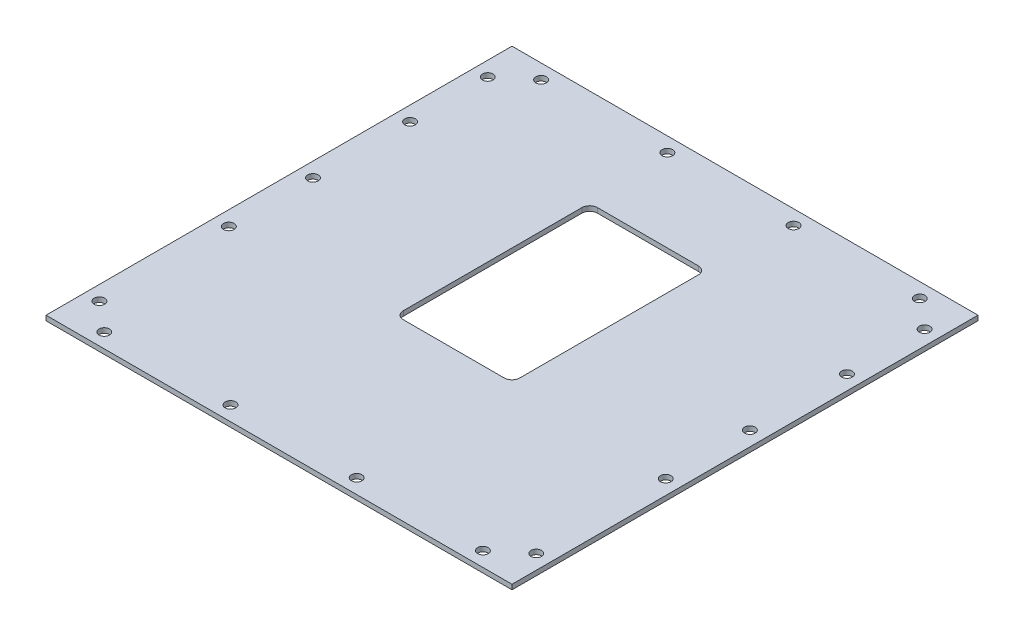
from build123d import *

# Parameters (mm, degrees)
SKETCH2_W                 = 152.4
SKETCH2_H                 = 152.4
BOSS_EXTRUDE1_DEPTH       = 1.5875
F_5_CLEARANCE_HOLE2_D     = 3.4544
F_5_CLEARANCE_HOLE3_D     = 3.4544
LPATTERN1_COUNT           = 4
LPATTERN1_PITCH           = 42.333333333
LPATTERN2_COUNT           = 4
LPATTERN2_PITCH           = 41.275
F_5_CLEARANCE_HOLE4_D     = 3.4544
F_5_CLEARANCE_HOLE4_DEPTH = 12.7
F_5_CLEARANCE_HOLE4_TIP   = 1.037806461
SKETCH12_W                = 38.1
SKETCH12_H                = 63.5
CUT_EXTRUDE1_DEPTH        = 2.54
FILLET2_R                 = 2.54


with BuildPart() as part:
    # Sketch2 → Boss-Extrude1 (new body)
    with BuildSketch(Plane(origin=(0, 0, 0), x_dir=(1, 0, 0), z_dir=(0, 1, 0))):
        with Locations((76.2, 76.2)):
            Rectangle(SKETCH2_W, SKETCH2_H)
    extrude(amount=BOSS_EXTRUDE1_DEPTH)

    # #5 Clearance Hole2 (through all)
    with Locations(Plane(origin=(0, 1.5875, 0), x_dir=(1, 0, 0), z_dir=(0, 1, 0))):
        with Locations((14.2875, 147.6375), (14.2875, 4.7625)):
            f_5_clearance_hole2 = Hole(F_5_CLEARANCE_HOLE2_D / 2)

    # #5 Clearance Hole3 (through all)
    with Locations(Plane(origin=(0, 1.5875, 0), x_dir=(1, 0, 0), z_dir=(0, 1, 0))):
        with Locations((4.7625, 139.7), (147.6375, 139.7)):
            f_5_clearance_hole3 = Hole(F_5_CLEARANCE_HOLE3_D / 2)

    # LPattern1: #5 Clearance Hole3 ×4, 1 skipped
    with Locations(*[(0, 0, i * LPATTERN1_PITCH) for i in range(1, LPATTERN1_COUNT) if i not in (1,)]):
        add(f_5_clearance_hole3, mode=Mode.SUBTRACT)

    # LPattern2: #5 Clearance Hole2 ×4
    with Locations(*[(i * LPATTERN2_PITCH, 0, 0) for i in range(1, LPATTERN2_COUNT)]):
        add(f_5_clearance_hole2, mode=Mode.SUBTRACT)

    # #5 Clearance Hole4
    with Locations(Plane(origin=(0, 1.5875, 0), x_dir=(1, 0, 0), z_dir=(0, 1, 0))):
        with Locations((147.6375, 114.3), (147.6375, 82.55), (4.7625, 82.55), (4.7625, 114.3)):
            Hole(F_5_CLEARANCE_HOLE4_D / 2, depth=F_5_CLEARANCE_HOLE4_DEPTH)
            with Locations((0, 0, -(F_5_CLEARANCE_HOLE4_DEPTH + F_5_CLEARANCE_HOLE4_TIP / 2))):  # 118° drill point
                Cone(0, F_5_CLEARANCE_HOLE4_D / 2, F_5_CLEARANCE_HOLE4_TIP, mode=Mode.SUBTRACT)

    # Sketch12 → Cut-Extrude1 (cut)
    with BuildSketch(Plane(origin=(0, 1.5875, 0), x_dir=(1, 0, 0), z_dir=(0, 1, 0))):
        with Locations((76.2, 88.9)):
            Rectangle(SKETCH12_W, SKETCH12_H)
    extrude(amount=-CUT_EXTRUDE1_DEPTH, mode=Mode.SUBTRACT)

    # Fillet2
    fillet2_edges = [part.edges().sort_by_distance(p)[0] for p in [
        (95.25, 0.79375, -57.15),
        (57.15, 0.79375, -57.15),
        (57.15, 0.79375, -120.65),
        (95.25, 0.79375, -120.65),
    ]]
    fillet(fillet2_edges, radius=FILLET2_R)


solid = part.part
